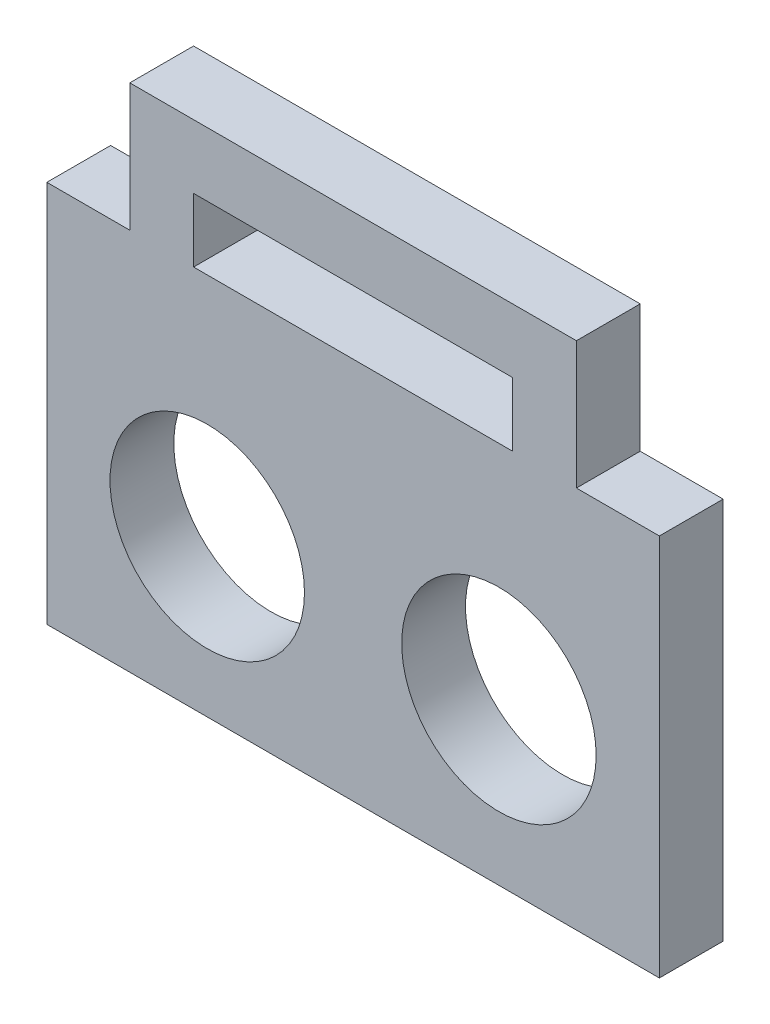
from build123d import *

# Parameters (mm, degrees)
SKICA1_W                = 25
SKICA1_H                = 5
SKICA1_R                = 7.62
P_IDAT_VYSUNUT_M1_DEPTH = 5


with BuildPart() as part:
    # Skica1 → Přidat vysunutím1 (new body)
    with BuildSketch(Plane.XY):
        Polygon((-13.243861265, 5.499663067), (-19.743861265, 5.499663067), (-19.743861265, -24.500336933), (28.256138735, -24.500336933), (28.256138735, 5.499663067), (21.756138735, 5.499663067), (21.756138735, 15.499663067), (-13.243861265, 15.499663067), align=None)
        with Locations((4.256138735, 7.999663067)):
            Rectangle(SKICA1_W, SKICA1_H, mode=Mode.SUBTRACT)
        with Locations((-7.173861265, -12.250168466)):
            Circle(SKICA1_R, mode=Mode.SUBTRACT)
        with Locations((15.683146952, -11.880336933)):
            Circle(SKICA1_R, mode=Mode.SUBTRACT)
    extrude(amount=P_IDAT_VYSUNUT_M1_DEPTH)


solid = part.part
